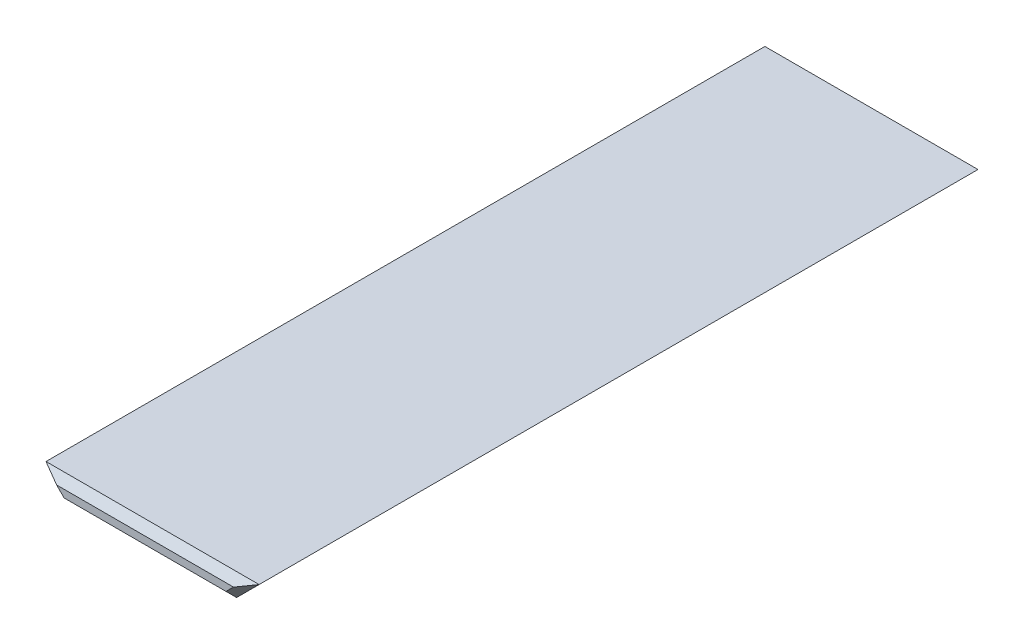
from build123d import *

# Parameters (mm, degrees)
BOSS_EXTRU_1_DEPTH = 96.8
CHANFREIN1_SIZE    = 1
CHANFREIN2_SIZE    = 3


with BuildPart() as part:
    # Esquisse1 → Boss.-Extru.1 (new body)
    with BuildSketch(Plane.XY):
        Polygon((-11.2, 0), (11.2, 0), (14.2, 3), (-14.2, 3), align=None)
    extrude(amount=BOSS_EXTRU_1_DEPTH)

    # Chanfrein1
    chanfrein1_edges = [part.edges().sort_by_distance(p)[0] for p in [
        (-12.7, 1.5, 96.8),
        (0, 0, 96.8),
        (12.7, 1.5, 96.8),
        (0, 3, 96.8),
    ]]
    chamfer(chanfrein1_edges, length=CHANFREIN1_SIZE)

    # Chanfrein2
    chanfrein2_edges = [part.edges().sort_by_distance(p)[0] for p in [
        (0, 0, 0),
    ]]
    chamfer(chanfrein2_edges, length=CHANFREIN2_SIZE - 0.0001)  # a hair under: the kernel refuses the full size


solid = part.part
